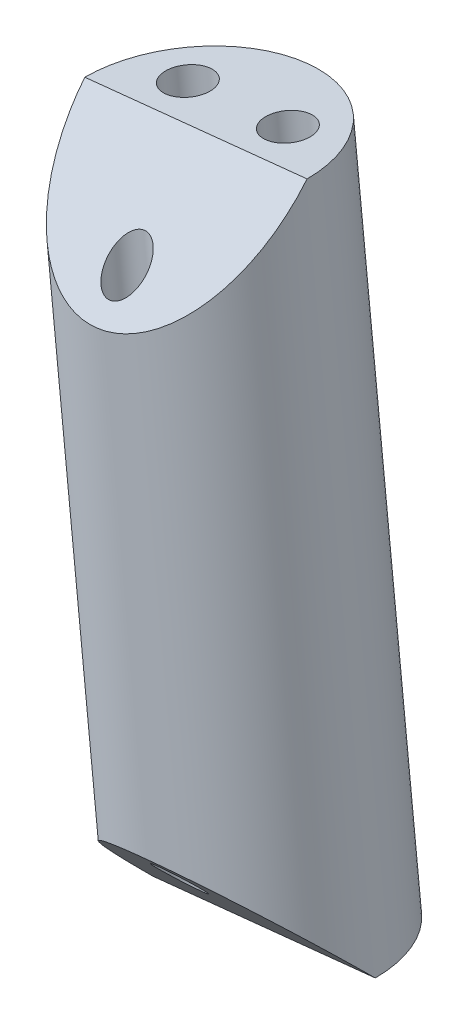
from build123d import *

# Parameters (mm, degrees)
SKETCH3_R               = 8
BOSS_EXTRUDE1_DEPTH     = 47.368421053
CUT_EXTRUDE1_DEPTH      = 200.187264303
CUT_EXTRUDE1_DEPTH_BACK = 200.187264303
CUT_EXTRUDE3_DEPTH      = 53.909855032
CUT_EXTRUDE3_DEPTH_BACK = 53.909855032
SKETCH8_R               = 1.4
SKETCH8_R_2             = 1.6


with BuildPart() as part:
    # Sketch3 → Boss-Extrude1 (new body)
    with BuildSketch(Plane(origin=(-20.344467381, 196.178792599, 0), x_dir=(-0.9946657577296572, -0.10315052302381678, 0), z_dir=(0.10315052302381678, -0.9946657577296572, 0))):
        with Locations((-10.431405186, 0)):
            Circle(SKETCH3_R)
    extrude(amount=BOSS_EXTRUDE1_DEPTH)

    # Sketch4 → Cut-Extrude1 (cut, two sides: drawn at the far end of the back side and taken through both)
    with BuildSketch(Plane(origin=(10.375761543, 1.076004901, 0), x_dir=(0.10315052302381672, -0.9946657577296572, 0), z_dir=(-0.9946657577296572, -0.10315052302381673, 0)).offset(-CUT_EXTRUDE1_DEPTH_BACK)):
        Polygon((-197.230869842, 0), (-189.230869842, 8), (-197.230869842, 8), align=None)
        Polygon((-157.862448789, 8), (-149.862448789, 8), (-149.862448789, 0), align=None)
    extrude(amount=CUT_EXTRUDE1_DEPTH + CUT_EXTRUDE1_DEPTH_BACK, mode=Mode.SUBTRACT)

    # Sketch8 → Cut-Extrude3 (cut, two sides: drawn at the far end of the back side and taken through both)
    with BuildSketch(Plane(origin=(-20.344467381, 196.178792599, 0), x_dir=(0.9946657577296572, 0.10315052302381678, 0), z_dir=(-0.10315052302381678, 0.9946657577296572, 0)).offset(-CUT_EXTRUDE3_DEPTH_BACK)):
        with Locations((10.431405186, -5.5)):
            Circle(SKETCH8_R)
        with Locations((6.831405186, 3)):
            Circle(SKETCH8_R_2)
        with Locations((14.031405186, 3)):
            Circle(SKETCH8_R_2)
    extrude(amount=CUT_EXTRUDE3_DEPTH + CUT_EXTRUDE3_DEPTH_BACK, mode=Mode.SUBTRACT)


solid = part.part
